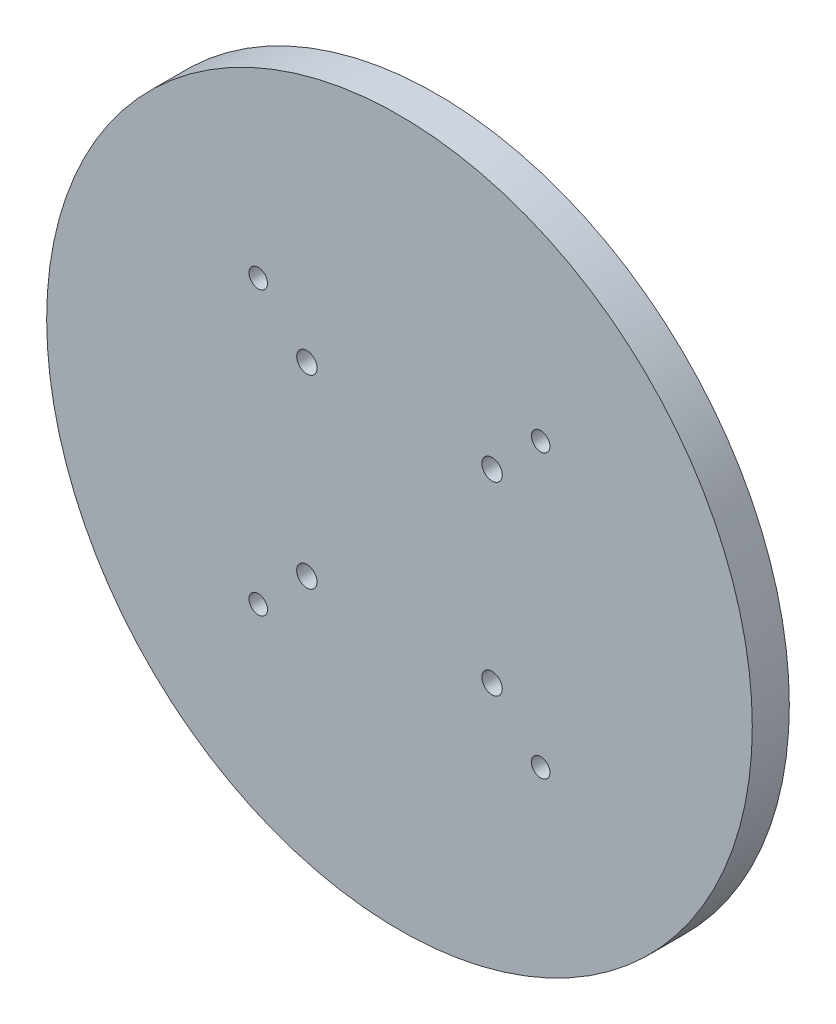
from build123d import *

# Parameters (mm, degrees)
SKETCH1_R           = 38.1
BOSS_EXTRUDE1_DEPTH = 4
SKETCH2_R           = 1.1
SKETCH2_R_2         = 1
CUT_EXTRUDE1_DEPTH  = 55.029806589


with BuildPart() as part:
    # Sketch1 → Boss-Extrude1 (new body)
    with BuildSketch(Plane.XY):
        Circle(SKETCH1_R)
    extrude(amount=BOSS_EXTRUDE1_DEPTH)

    # Sketch2 → Cut-Extrude1 (cut, through all)
    with BuildSketch(Plane.XY.offset(4)):
        with Locations((10, 10)):
            Circle(SKETCH2_R)
        with Locations((10, -10)):
            Circle(SKETCH2_R)
        with Locations((-10, -10)):
            Circle(SKETCH2_R)
        with Locations((-10, 10)):
            Circle(SKETCH2_R)
        with Locations((15.25, -15.25)):
            Circle(SKETCH2_R_2)
        with Locations((-15.25, -15.25)):
            Circle(SKETCH2_R_2)
        with Locations((-15.25, 15.25)):
            Circle(SKETCH2_R_2)
        with Locations((15.25, 15.25)):
            Circle(SKETCH2_R_2)
    extrude(amount=-CUT_EXTRUDE1_DEPTH, mode=Mode.SUBTRACT)


solid = part.part
